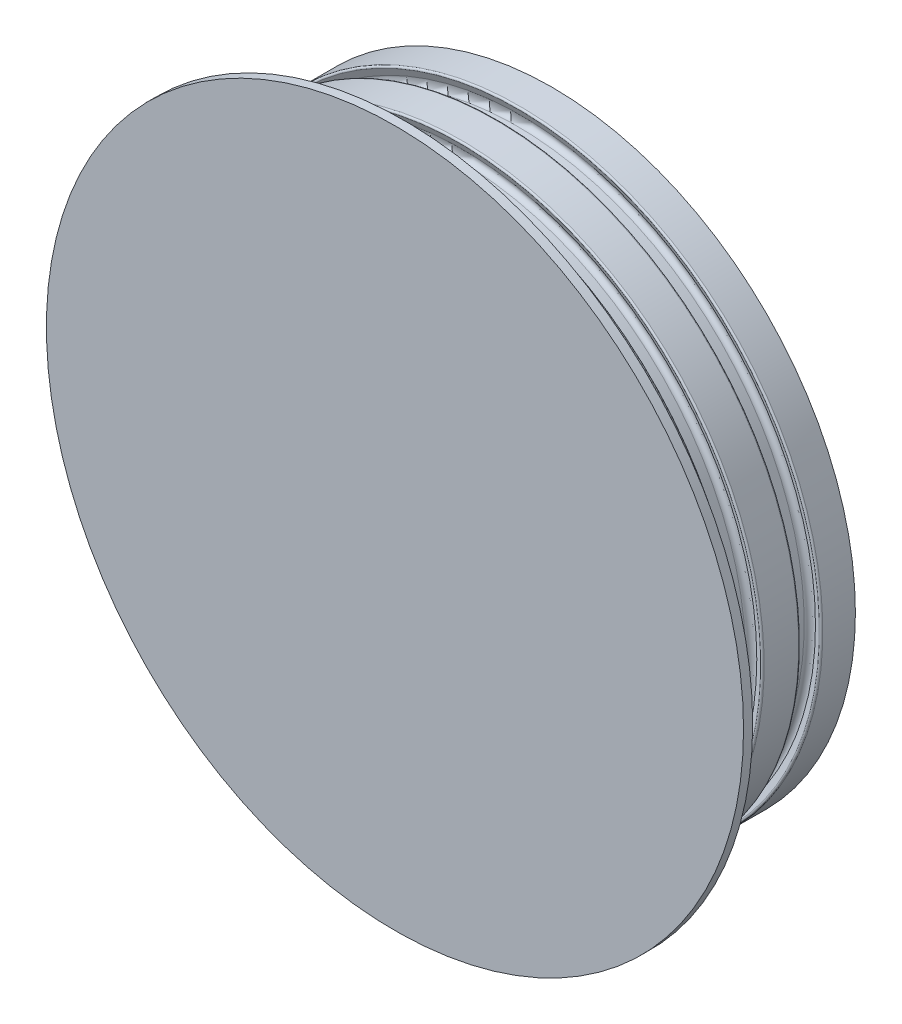
from build123d import *
from build123d.topology import SkipClean

# Parameters (mm, degrees)
SKETCH1_R            = 24.875
BOSS_EXTRUDE1_DEPTH  = 12.12
SKETCH3_R            = 23
CUT_EXTRUDE1_DEPTH   = 10.12
CUT_EXTRUDE2_DEPTH   = 2
SKETCH13_R           = 28.575
BOSS_EXTRUDE11_DEPTH = 0.75
FILLET1_R            = 3
FILLET2_R            = 3
SKETCH15_R           = 2
SKETCH15_W           = 10
SKETCH15_H           = 29.48075205
CUT_EXTRUDE3_DEPTH   = 0.5
BOSS_EXTRUDE12_START = 2
SKETCH16_R           = 0.75
BOSS_EXTRUDE12_DEPTH = 2


with BuildPart() as part:
    # Sketch1 → Boss-Extrude1 (new body)
    with BuildSketch(Plane.XY):
        Circle(SKETCH1_R)
    extrude(amount=BOSS_EXTRUDE1_DEPTH)

    # Sketch2 → Cut-Revolve1 (revolve, cut)
    with BuildSketch(Plane(origin=(0, 0, 0), x_dir=(1, 0, 0), z_dir=(0, 1, 0)), mode=Mode.PRIVATE) as cut_revolve1_sk:
        with BuildLine():
            Line((24.696344446, -4.525283456), (24.135358605, -4.775050444))
            ThreePointArc((24.135358605, -4.775050444), (23.757781383, -4.745334472), (23.57706, -4.412487091))
            Line((23.57706, -4.412487091), (23.57706, -2.896875))
            ThreePointArc((23.57706, -2.896875), (23.757781383, -2.564027618), (24.135358605, -2.534311646))
            Line((24.135358605, -2.534311646), (24.696344446, -2.784078635))
            ThreePointArc((24.696344446, -2.784078635), (24.817169157, -2.774569524), (24.875, -2.668058362))
            Line((24.875, -2.668058362), (24.875, -4.641303729))
            ThreePointArc((24.875, -4.641303729), (24.817169157, -4.534792567), (24.696344446, -4.525283456))
        make_face()
        with BuildLine():
            Line((24.696344446, -9.334645546), (24.135358605, -9.584412535))
            ThreePointArc((24.135358605, -9.584412535), (23.757781383, -9.554696563), (23.57706, -9.221849181))
            Line((23.57706, -9.221849181), (23.57706, -7.706237091))
            ThreePointArc((23.57706, -7.706237091), (23.757781383, -7.373389709), (24.135358605, -7.343673737))
            Line((24.135358605, -7.343673737), (24.696344446, -7.593440726))
            ThreePointArc((24.696344446, -7.593440726), (24.817169157, -7.583931615), (24.875, -7.477420453))
            Line((24.875, -7.477420453), (24.875, -9.450665819))
            ThreePointArc((24.875, -9.450665819), (24.817169157, -9.344154657), (24.696344446, -9.334645546))
        make_face()
    revolve(cut_revolve1_sk.sketch.rotate(Axis((0, 0, 0), (0, 0, 1)), 180), axis=Axis((0, 0, 0), (0, 0, 1)), mode=Mode.SUBTRACT)

    # Sketch3 → Cut-Extrude1 (cut)
    with BuildSketch(Plane(origin=(0, 0, 0), x_dir=(-1, 0, 0), z_dir=(0, 0, -1))):
        Circle(SKETCH3_R)
    extrude(amount=-CUT_EXTRUDE1_DEPTH, mode=Mode.SUBTRACT)

    # Sketch4 → Cut-Extrude2 (cut)
    with SkipClean():  # the faces are left unmerged after this step: merging them gives an invalid solid
        with BuildSketch(Plane(origin=(0, 0, 10.12), x_dir=(-1, 0, 0), z_dir=(0, 0, -1))):
            with BuildLine():
                Line((-21.9089023, 7), (-4.9089023, 7))
                Line((-4.9089023, 7), (-4.9089023, -7))
                Line((-4.9089023, -7), (-21.9089023, -7))
                ThreePointArc((-21.9089023, -7), (-23, 0), (-21.9089023, 7))
            make_face()
        extrude(amount=-CUT_EXTRUDE2_DEPTH, mode=Mode.SUBTRACT)

    # Sketch13 → Boss-Extrude11 (add)
    with SkipClean():  # the faces are left unmerged after this step: merging them gives an invalid solid
        with BuildSketch(Plane.XY.offset(12.12)):
            Circle(SKETCH13_R)
        extrude(amount=BOSS_EXTRUDE11_DEPTH)

    # Fillet1
    # the kernel refuses this fillet: 3 mm, written as the material it takes off along each edge
    with BuildSketch(Plane(origin=(4.9089023, 7, 10.12), x_dir=(-1, 0, 0), z_dir=(0, -1, 0))) as fillet1_piece_1:
        with BuildLine():
            CenterArc((2.828427125, -3), FILLET1_R, 90, 70.528779366)
            Line((0, -2), (-0.056568542, -1.98))
            ThreePointArc((-0.056568542, -1.98), (-0.06, -1), (-0.06, 0))
            Line((-0.06, 0), (0, 0.06))
            Line((0, 0.06), (2.828427125, 0.06))
            Line((2.828427125, 0.06), (2.828427125, 0))
        make_face()
    extrude(amount=14, mode=Mode.SUBTRACT)

    # Fillet2
    # the kernel refuses this fillet: 3 mm, written as the material it adds along each edge
    with BuildSketch(Plane(origin=(4.9089023, 11.109272076, 12.12), x_dir=(-0.5096537321044121, 0, -0.8603796100280643), z_dir=(0, -1, 0))) as fillet2_piece_1:
        with BuildLine():
            CenterArc((1.74341649, 2.943174759), FILLET2_R, 210.640767765, 48.189685104)
            Line((-0.83772234, 1.414213562), (0, 0))
            ThreePointArc((0, 0), (0.58113883, 0.056825241), (1.16227766, 0))
        make_face()
    extrude(amount=22.218544151)

    # Sketch15 → Cut-Extrude3 (cut)
    with BuildSketch(Plane(origin=(0, 0, 10.12), x_dir=(-1, 0, 0), z_dir=(0, 0, -1))):
        with Locations((-11.642490831, 11)):
            Circle(SKETCH15_R)
        with Locations(Location((-11.642490831, -11, 0), (0, 0, 180))):
            Circle(SKETCH15_R)
        with Locations((10, 0)):
            Rectangle(SKETCH15_W, SKETCH15_H)
    extrude(amount=-CUT_EXTRUDE3_DEPTH, mode=Mode.SUBTRACT)

    # Sketch16 → Boss-Extrude12 (add)
    with SkipClean():  # the faces are left unmerged after this step: merging them gives an invalid solid
        with BuildSketch(Plane(origin=(0, 0, 12.12), x_dir=(-1, 0, 0), z_dir=(0, 0, -1)).offset(BOSS_EXTRUDE12_START)):
            with Locations(Location((-13.58148036, -2.15, 0), (0, 0, 180))):
                Circle(SKETCH16_R)
            with Locations(Location((-13.58148036, 2.15, 0), (0, 0, 180))):
                Circle(SKETCH16_R)
            with BuildLine():
                Line((-22.622499862, 4.15), (-19.399290382, 4.15))
                Line((-19.399290382, 4.15), (-19.399290382, 2.15))
                Line((-19.399290382, 2.15), (-22.899290382, 2.15))
                ThreePointArc((-22.899290382, 2.15), (-22.782852033, 3.153038732), (-22.622499862, 4.15))
            make_face()
            with BuildLine():
                Line((-19.399290382, -2.15), (-22.899290382, -2.15))
                ThreePointArc((-22.899290382, -2.15), (-22.782852033, -3.153038732), (-22.622499862, -4.15))
                Line((-22.622499862, -4.15), (-19.399290382, -4.15))
                Line((-19.399290382, -4.15), (-19.399290382, -2.15))
            make_face()
        extrude(amount=-BOSS_EXTRUDE12_DEPTH)


solid = part.part
